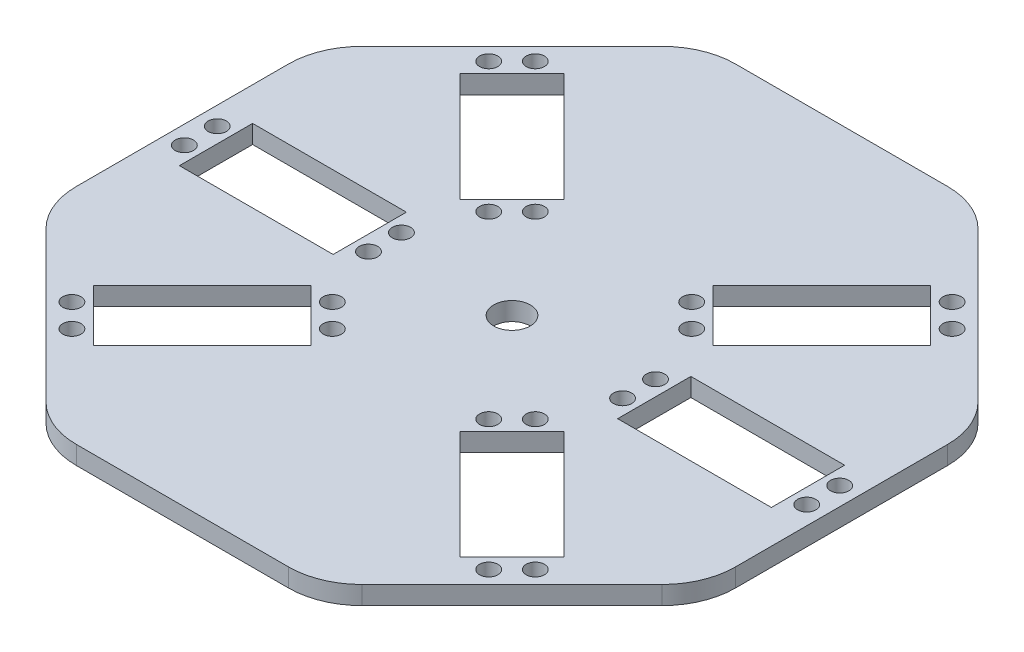
from build123d import *

# Parameters (mm, degrees)
SKETCH1_R           = 2.5
SKETCH1_W           = 42
SKETCH1_H           = 20
BOSS_EXTRUDE1_DEPTH = 5
FILLET1_R           = 20
SKETCH2_R           = 5
CUT_EXTRUDE1_DEPTH  = 128.377392029


with BuildPart() as part:
    # Sketch1 → Boss-Extrude1 (new body)
    with BuildSketch(Plane(origin=(0, 0, 0), x_dir=(1, 0, 0), z_dir=(0, 1, 0))):
        Polygon((-90, 37.279220614), (-90, -37.279220614), (-37.279220614, -90), (37.279220614, -90), (90, -37.279220614), (90, 37.279220614), (37.279220614, 90), (-37.279220614, 90), align=None)
        with Locations((21.354624792, -27.718585823)):
            Circle(SKETCH1_R, mode=Mode.SUBTRACT)
        with Locations((27.718585823, -21.354624792)):
            Circle(SKETCH1_R, mode=Mode.SUBTRACT)
        Polygon((34.542166261, -20.400030637), (64.240651071, -50.098515447), (50.098515447, -64.240651071), (20.400030637, -34.542166261), align=None, mode=Mode.SUBTRACT)
        with Locations((-56.922095886, -63.286056916)):
            Circle(SKETCH1_R, mode=Mode.SUBTRACT)
        with Locations((-63.286056916, -56.922095886)):
            Circle(SKETCH1_R, mode=Mode.SUBTRACT)
        with Locations((-85, -4.5)):
            Circle(SKETCH1_R, mode=Mode.SUBTRACT)
        Polygon((-34.542166261, -20.400030637), (-20.400030637, -34.542166261), (-50.098515447, -64.240651071), (-64.240651071, -50.098515447), align=None, mode=Mode.SUBTRACT)
        with Locations((-21.354624792, -27.718585823)):
            Circle(SKETCH1_R, mode=Mode.SUBTRACT)
        with Locations((-27.718585823, -21.354624792)):
            Circle(SKETCH1_R, mode=Mode.SUBTRACT)
        with Locations((-34.7, -4.5)):
            Circle(SKETCH1_R, mode=Mode.SUBTRACT)
        with Locations((56.922095886, -63.286056916)):
            Circle(SKETCH1_R, mode=Mode.SUBTRACT)
        with Locations((63.286056916, -56.922095886)):
            Circle(SKETCH1_R, mode=Mode.SUBTRACT)
        with Locations((63.286056916, 56.922095886)):
            Circle(SKETCH1_R, mode=Mode.SUBTRACT)
        with Locations((56.922095886, 63.286056916)):
            Circle(SKETCH1_R, mode=Mode.SUBTRACT)
        with Locations((34.7, -4.5)):
            Circle(SKETCH1_R, mode=Mode.SUBTRACT)
        with Locations((85, -4.5)):
            Circle(SKETCH1_R, mode=Mode.SUBTRACT)
        with Locations((-85, 4.5)):
            Circle(SKETCH1_R, mode=Mode.SUBTRACT)
        with Locations((-59.85, 0)):
            Rectangle(SKETCH1_W, SKETCH1_H, mode=Mode.SUBTRACT)
        with Locations((-34.7, 4.5)):
            Circle(SKETCH1_R, mode=Mode.SUBTRACT)
        with Locations((-27.718585823, 21.354624792)):
            Circle(SKETCH1_R, mode=Mode.SUBTRACT)
        Polygon((-20.400030637, 34.542166261), (-34.542166261, 20.400030637), (-64.240651071, 50.098515447), (-50.098515447, 64.240651071), align=None, mode=Mode.SUBTRACT)
        with Locations((-21.354624792, 27.718585823)):
            Circle(SKETCH1_R, mode=Mode.SUBTRACT)
        with Locations((-63.286056916, 56.922095886)):
            Circle(SKETCH1_R, mode=Mode.SUBTRACT)
        with Locations((-56.922095886, 63.286056916)):
            Circle(SKETCH1_R, mode=Mode.SUBTRACT)
        with Locations((34.7, 4.5)):
            Circle(SKETCH1_R, mode=Mode.SUBTRACT)
        with Locations((27.718585823, 21.354624792)):
            Circle(SKETCH1_R, mode=Mode.SUBTRACT)
        with Locations((21.354624792, 27.718585823)):
            Circle(SKETCH1_R, mode=Mode.SUBTRACT)
        Polygon((34.542166261, 20.400030637), (20.400030637, 34.542166261), (50.098515447, 64.240651071), (64.240651071, 50.098515447), align=None, mode=Mode.SUBTRACT)
        with Locations((59.85, 0)):
            Rectangle(SKETCH1_W, SKETCH1_H, mode=Mode.SUBTRACT)
        with Locations((85, 4.5)):
            Circle(SKETCH1_R, mode=Mode.SUBTRACT)
    extrude(amount=BOSS_EXTRUDE1_DEPTH)

    # Fillet1
    fillet1_edges = [part.edges().sort_by_distance(p)[0] for p in [
        (-90, 2.5, -37.279220614),
        (-37.279220614, 2.5, -90),
        (37.279220614, 2.5, -90),
        (90, 2.5, -37.279220614),
        (90, 2.5, 37.279220614),
        (37.279220614, 2.5, 90),
        (-37.279220614, 2.5, 90),
        (-90, 2.5, 37.279220614),
    ]]
    fillet(fillet1_edges, radius=FILLET1_R)

    # Sketch2 → Cut-Extrude1 (cut, through all)
    with BuildSketch(Plane(origin=(0, 5, 0), x_dir=(1, 0, 0), z_dir=(0, 1, 0))):
        Circle(SKETCH2_R)
    extrude(amount=-CUT_EXTRUDE1_DEPTH, mode=Mode.SUBTRACT)


solid = part.part
